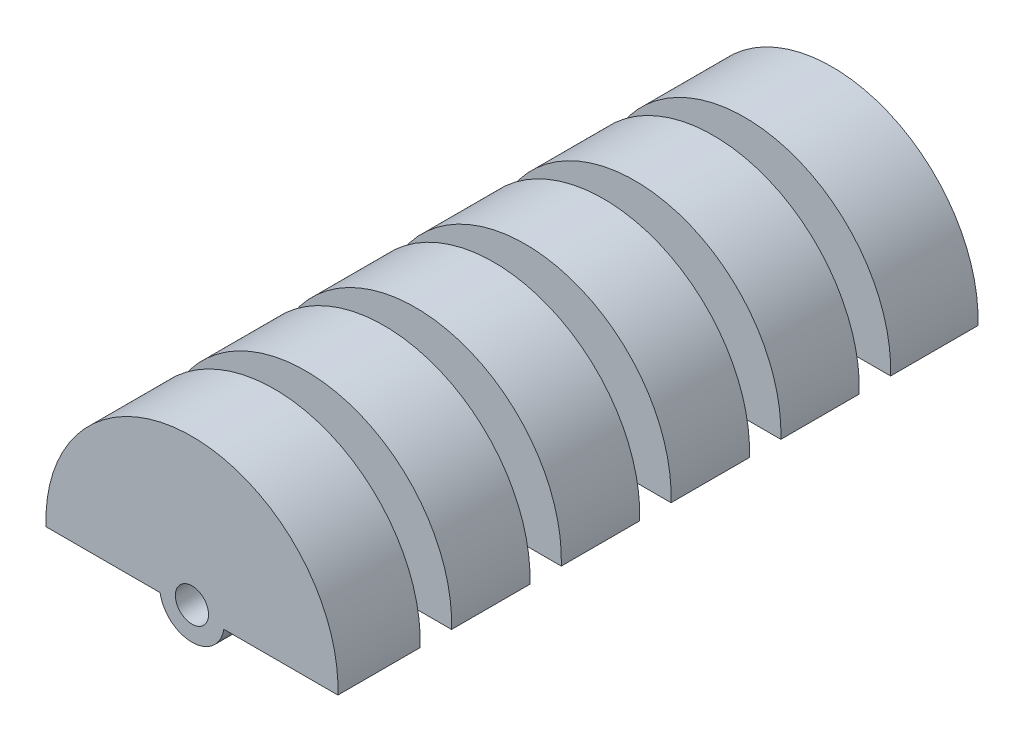
from build123d import *

# Parameters (mm, degrees)
SKETCH3_R            = 27.94
BOSS_EXTRUDE2_DEPTH  = 122.46
SKETCH5_R            = 3.175
CUT_EXTRUDE1_DEPTH   = 129.676877488
SKETCH4_W            = 14
SKETCH4_H            = 6
SHELL1_START         = 3
SHELL1_OUTLINE_R     = 10.94
SHELL1_OUTLINE_R_2   = 6.175
SHELL1_DEPTH         = 116.46
SHELL1_2_OUTLINE_R   = 24.94
SHELL1_2_OUTLINE_R_2 = 10.94
SHELL1_2_DEPTH       = 10.72
SHELL1_START_2       = 109.72
SHELL1_3_OUTLINE_R   = 24.94
SHELL1_3_OUTLINE_R_2 = 10.94
SHELL1_3_DEPTH       = 9.74
SHELL1_START_3       = 25.72
SHELL1_4_OUTLINE_R   = 24.94
SHELL1_4_OUTLINE_R_2 = 10.94
SHELL1_4_DEPTH       = 9
SHELL1_START_4       = 46.72
SHELL1_5_OUTLINE_R   = 24.94
SHELL1_5_OUTLINE_R_2 = 10.94
SHELL1_5_DEPTH       = 9
SHELL1_START_5       = 67.72
SHELL1_6_OUTLINE_R   = 24.94
SHELL1_6_OUTLINE_R_2 = 10.94
SHELL1_6_DEPTH       = 9
SHELL1_START_6       = 88.72
SHELL1_7_OUTLINE_R   = 24.94
SHELL1_7_OUTLINE_R_2 = 10.94
SHELL1_7_DEPTH       = 9
BOSS_EXTRUDE3_REACH  = 130.677
SKETCH13_W           = 16.483162312
SKETCH13_H           = 6
CUT_EXTRUDE3_DEPTH   = 123


# Read off the part's stored shape, not the designer's step: Shell1
with BuildPart() as part:
    # Sketch3 → Boss-Extrude2 (new body)
    with BuildSketch(Plane.XY):
        Circle(SKETCH3_R)
    extrude(amount=BOSS_EXTRUDE2_DEPTH)

    # Sketch5 → Cut-Extrude1 (cut, through all)
    with BuildSketch(Plane.XY.offset(122.46)):
        Circle(SKETCH5_R)
    extrude(amount=-CUT_EXTRUDE1_DEPTH, mode=Mode.SUBTRACT)

    # Sketch4 → Cut-Revolve1 (revolve, cut)
    with BuildSketch(Plane(origin=(0, 0, 0), x_dir=(1, 0, 0), z_dir=(0, 1, 0)), mode=Mode.PRIVATE) as cut_revolve1_sk:
        with Locations((-20.94, -103.72)):
            Rectangle(SKETCH4_W, SKETCH4_H)
        with Locations((-20.94, -82.72)):
            Rectangle(SKETCH4_W, SKETCH4_H)
        with Locations((-20.94, -61.72)):
            Rectangle(SKETCH4_W, SKETCH4_H)
        with Locations((-20.94, -40.72)):
            Rectangle(SKETCH4_W, SKETCH4_H)
        with Locations((-20.94, -19.72)):
            Rectangle(SKETCH4_W, SKETCH4_H)
    revolve(cut_revolve1_sk.sketch.rotate(Axis((0, 0, 122.46), (0, 0, -1)), 180), axis=Axis((0, 0, 122.46), (0, 0, -1)), mode=Mode.SUBTRACT)

    # Shell1 outline → Shell1 (cut)
    with BuildSketch(Plane.XY.offset(SHELL1_START)):
        Circle(SHELL1_OUTLINE_R)
        Circle(SHELL1_OUTLINE_R_2, mode=Mode.SUBTRACT)
    extrude(amount=SHELL1_DEPTH, mode=Mode.SUBTRACT)

    # Shell1 2 outline → Shell1 2 (cut)
    with BuildSketch(Plane.XY.offset(SHELL1_START)):
        Circle(SHELL1_2_OUTLINE_R)
        Circle(SHELL1_2_OUTLINE_R_2, mode=Mode.SUBTRACT)
    extrude(amount=SHELL1_2_DEPTH, mode=Mode.SUBTRACT)

    # Shell1 3 outline → Shell1 3 (cut)
    with BuildSketch(Plane.XY.offset(SHELL1_START_2)):
        Circle(SHELL1_3_OUTLINE_R)
        Circle(SHELL1_3_OUTLINE_R_2, mode=Mode.SUBTRACT)
    extrude(amount=SHELL1_3_DEPTH, mode=Mode.SUBTRACT)

    # Shell1 4 outline → Shell1 4 (cut)
    with BuildSketch(Plane.XY.offset(SHELL1_START_3)):
        Circle(SHELL1_4_OUTLINE_R)
        Circle(SHELL1_4_OUTLINE_R_2, mode=Mode.SUBTRACT)
    extrude(amount=SHELL1_4_DEPTH, mode=Mode.SUBTRACT)

    # Shell1 5 outline → Shell1 5 (cut)
    with BuildSketch(Plane.XY.offset(SHELL1_START_4)):
        Circle(SHELL1_5_OUTLINE_R)
        Circle(SHELL1_5_OUTLINE_R_2, mode=Mode.SUBTRACT)
    extrude(amount=SHELL1_5_DEPTH, mode=Mode.SUBTRACT)

    # Shell1 6 outline → Shell1 6 (cut)
    with BuildSketch(Plane.XY.offset(SHELL1_START_5)):
        Circle(SHELL1_6_OUTLINE_R)
        Circle(SHELL1_6_OUTLINE_R_2, mode=Mode.SUBTRACT)
    extrude(amount=SHELL1_6_DEPTH, mode=Mode.SUBTRACT)

    # Shell1 7 outline → Shell1 7 (cut)
    with BuildSketch(Plane.XY.offset(SHELL1_START_6)):
        Circle(SHELL1_7_OUTLINE_R)
        Circle(SHELL1_7_OUTLINE_R_2, mode=Mode.SUBTRACT)
    extrude(amount=SHELL1_7_DEPTH, mode=Mode.SUBTRACT)

    # Boss-Extrude3: up to this face of the body (flat: up to its plane)
    boss_extrude3_end = Plane(part.part.faces().sort_by_distance((-27.149737461, 0, 122.46))[0])
    # Sketch10 → Boss-Extrude3 (add, up to the picked face)
    with BuildSketch(Plane(origin=(0, 0, 0), x_dir=(-1, 0, 0), z_dir=(0, 0, -1)), mode=Mode.PRIVATE) as boss_extrude3_sk1:
        with BuildLine():
            Line((-1, 27.922098775), (-1, 3.01340754))
            ThreePointArc((-1, 3.01340754), (0, 3.175), (1, 3.01340754))
            Line((1, 3.01340754), (1, 27.922098775))
            ThreePointArc((1, 27.922098775), (0, 27.94), (-1, 27.922098775))
        make_face()
    boss_extrude3_tool1 = split(extrude(boss_extrude3_sk1.sketch, amount=-BOSS_EXTRUDE3_REACH, mode=Mode.PRIVATE), bisect_by=boss_extrude3_end, keep=Keep.BOTH, mode=Mode.PRIVATE)
    # Sketch10 → Boss-Extrude3 (add, up to the picked face)
    with BuildSketch(Plane(origin=(0, 0, 0), x_dir=(-1, 0, 0), z_dir=(0, 0, -1)), mode=Mode.PRIVATE) as boss_extrude3_sk2:
        with BuildLine():
            Line((3.01340754, 1), (27.922098775, 1))
            ThreePointArc((27.922098775, 1), (27.94, 0), (27.922098775, -1))
            Line((27.922098775, -1), (3.01340754, -1))
            ThreePointArc((3.01340754, -1), (3.175, 0), (3.01340754, 1))
        make_face()
    boss_extrude3_tool2 = split(extrude(boss_extrude3_sk2.sketch, amount=-BOSS_EXTRUDE3_REACH, mode=Mode.PRIVATE), bisect_by=boss_extrude3_end, keep=Keep.BOTH, mode=Mode.PRIVATE)
    # Sketch10 → Boss-Extrude3 (add, up to the picked face)
    with BuildSketch(Plane(origin=(0, 0, 0), x_dir=(-1, 0, 0), z_dir=(0, 0, -1)), mode=Mode.PRIVATE) as boss_extrude3_sk3:
        with BuildLine():
            Line((-1, -3.01340754), (-1, -27.922098775))
            ThreePointArc((-1, -27.922098775), (0, -27.94), (1, -27.922098775))
            Line((1, -27.922098775), (1, -3.01340754))
            ThreePointArc((1, -3.01340754), (0, -3.175), (-1, -3.01340754))
        make_face()
    boss_extrude3_tool3 = split(extrude(boss_extrude3_sk3.sketch, amount=-BOSS_EXTRUDE3_REACH, mode=Mode.PRIVATE), bisect_by=boss_extrude3_end, keep=Keep.BOTH, mode=Mode.PRIVATE)
    # Sketch10 → Boss-Extrude3 (add, up to the picked face)
    with BuildSketch(Plane(origin=(0, 0, 0), x_dir=(-1, 0, 0), z_dir=(0, 0, -1)), mode=Mode.PRIVATE) as boss_extrude3_sk4:
        with BuildLine():
            Line((-27.922098775, -1), (-3.01340754, -1))
            ThreePointArc((-3.01340754, -1), (-3.175, 0), (-3.01340754, 1))
            Line((-3.01340754, 1), (-27.922098775, 1))
            ThreePointArc((-27.922098775, 1), (-27.94, 0), (-27.922098775, -1))
        make_face()
    boss_extrude3_tool4 = split(extrude(boss_extrude3_sk4.sketch, amount=-BOSS_EXTRUDE3_REACH, mode=Mode.PRIVATE), bisect_by=boss_extrude3_end, keep=Keep.BOTH, mode=Mode.PRIVATE)
    add(boss_extrude3_tool1.solids().sort_by(Axis((0, 15.527819, 0), (0, 0, 1)))[0])
    add(boss_extrude3_tool2.solids().sort_by(Axis((-15.527819, 0, 0), (0, 0, 1)))[0])
    add(boss_extrude3_tool3.solids().sort_by(Axis((0, -15.527819, 0), (0, 0, 1)))[0])
    add(boss_extrude3_tool4.solids().sort_by(Axis((15.527819, 0, 0), (0, 0, 1)))[0])

    # Sketch13 → Cut-Revolve2 (revolve, cut)
    with BuildSketch(Plane(origin=(0, 0, 0), x_dir=(1, 0, 0), z_dir=(0, 1, 0)), mode=Mode.PRIVATE) as cut_revolve2_sk:
        with Locations((-22.145666886, -40.72)):
            Rectangle(SKETCH13_W, SKETCH13_H)
        with Locations((-22.145666886, -19.72)):
            Rectangle(SKETCH13_W, SKETCH13_H)
        with Locations((-22.145666886, -61.72)):
            Rectangle(SKETCH13_W, SKETCH13_H)
        with Locations((-22.145666886, -82.72)):
            Rectangle(SKETCH13_W, SKETCH13_H)
        with Locations((-22.145666886, -103.72)):
            Rectangle(SKETCH13_W, SKETCH13_H)
    revolve(cut_revolve2_sk.sketch.rotate(Axis((0, 0, 121.588746248), (0, 0, -1)), 180), axis=Axis((0, 0, 121.588746248), (0, 0, -1)), mode=Mode.SUBTRACT)

    # Sketch16 → Cut-Extrude3 (cut)
    with BuildSketch(Plane(origin=(0, 0, 0), x_dir=(-1, 0, 0), z_dir=(0, 0, -1))):
        with BuildLine():
            Line((-27.923120749, -0.971044624), (-6.098171639, -0.971044624))
            ThreePointArc((-6.098171639, -0.971044624), (-0.014665674, -6.174982584), (6.093490379, -1))
            Line((6.093490379, -1), (27.922098775, -1))
            ThreePointArc((27.922098775, -1), (-0.014486703, -27.939996244), (-27.923120749, -0.971044624))
        make_face()
    extrude(amount=-CUT_EXTRUDE3_DEPTH, mode=Mode.SUBTRACT)


solid = part.part
